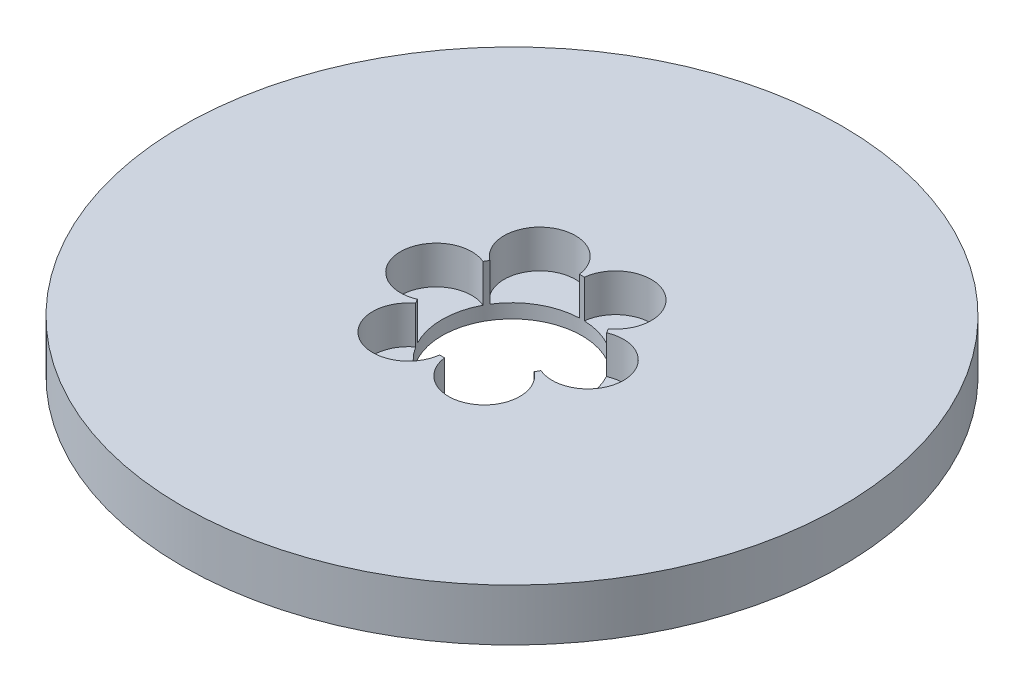
from build123d import *

# Parameters (mm, degrees)
SKETCH1_R           = 82.5
BOSS_EXTRUDE1_DEPTH = 13
SKETCH2_R           = 17.5
CUT_EXTRUDE1_DEPTH  = 118.394633608
SKETCH3_R           = 8.931659519
CUT_EXTRUDE2_DEPTH  = 9.487125671
CIRPATTERN1_COUNT   = 6


with BuildPart() as part:
    # Sketch1 → Boss-Extrude1 (new body)
    with BuildSketch(Plane(origin=(0, 0, 0), x_dir=(1, 0, 0), z_dir=(0, 1, 0))):
        Circle(SKETCH1_R)
    extrude(amount=BOSS_EXTRUDE1_DEPTH)

    # Sketch2 → Cut-Extrude1 (cut, through all)
    with BuildSketch(Plane(origin=(0, 0, 0), x_dir=(1, 0, 0), z_dir=(0, 1, 0))):
        Circle(SKETCH2_R)
    extrude(amount=CUT_EXTRUDE1_DEPTH, mode=Mode.SUBTRACT)

    # Sketch3 → Cut-Extrude2 (cut)
    with BuildSketch(Plane(origin=(0, 13, 0), x_dir=(1, 0, 0), z_dir=(0, 1, 0))):
        with Locations((-18.989153976, 0)):
            Circle(SKETCH3_R)
    cut_extrude2 = extrude(amount=-CUT_EXTRUDE2_DEPTH, mode=Mode.SUBTRACT)

    # CirPattern1: Cut-Extrude2 ×6 about axis
    cirpattern1_axis = Axis((0, 0, 0), (0, 1, 0))
    for i in range(1, CIRPATTERN1_COUNT):
        add(cut_extrude2.rotate(cirpattern1_axis, i * 360 / CIRPATTERN1_COUNT), mode=Mode.SUBTRACT)


solid = part.part
